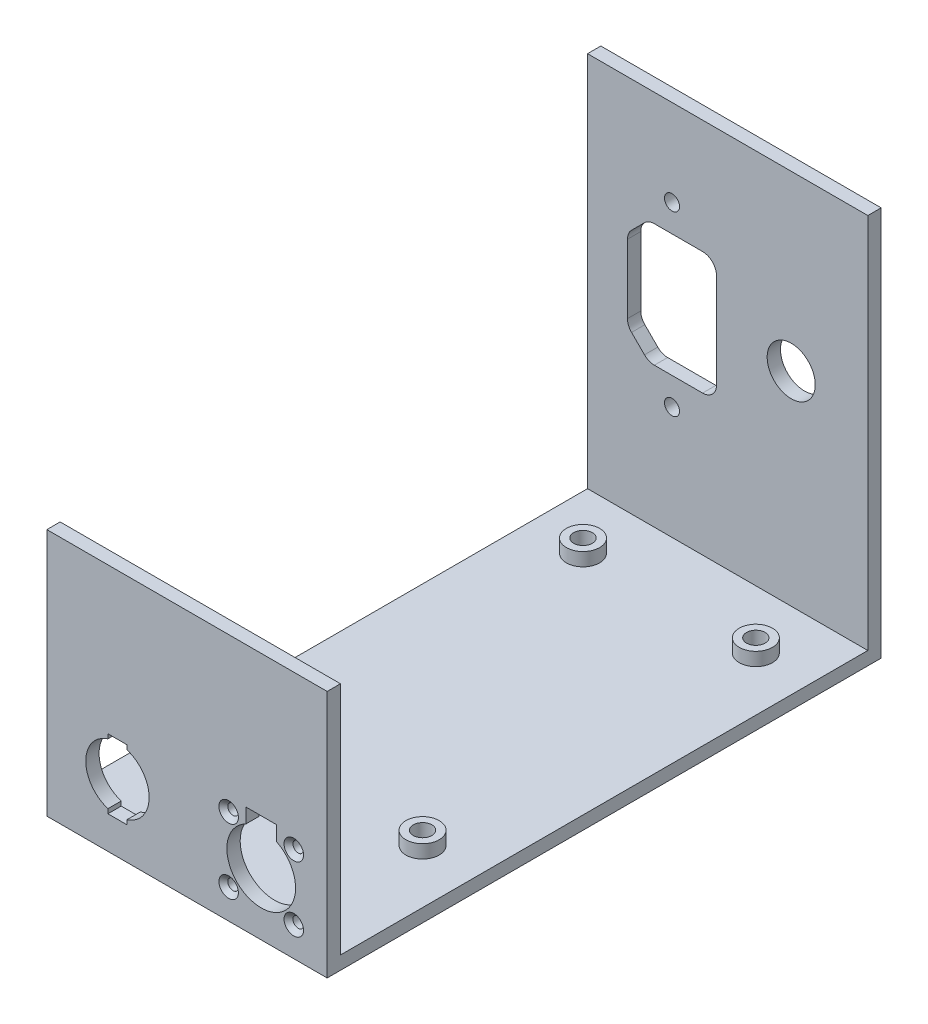
from build123d import *

# Parameters (mm, degrees)
SKETCH_2_R                  = 3.75
EXTRUDE_1_DEPTH             = 3
EXTRUDE_1_2_DEPTH           = 3
EXTRUDE_1_3_DEPTH           = 3
EXTRUDE_1_4_DEPTH           = 3
SKETCH_3_W                  = 63.25
SKETCH_3_H                  = 125
EXTRUDE_2_DEPTH             = 3
SKETCH_4_R                  = 2.1
CUT_EXTRUDE_1_DEPTH         = 4
SKETCH_5_W                  = 63.25
SKETCH_5_H                  = 3
EXTRUDE_3_DEPTH             = 53
CUT_EXTRUDE_2_DEPTH         = 10
HOLE_WIZARD_M21_D           = 2.4
HOLE_WIZARD_M21_DEPTH       = 5
HOLE_WIZARD_M21_CSINK_D     = 4.4
HOLE_WIZARD_M21_CSINK_ANGLE = 90
HOLE_WIZARD_M21_TIP         = 0.721032743
SKETCH_12_W                 = 63.25
SKETCH_12_H                 = 3
EXTRUDE_4_DEPTH             = 85
CUT_EXTRUDE_3_DEPTH         = 151.360036662
HOLE_WIZARD_M31_D           = 3.4
HOLE_WIZARD_M31_DEPTH       = 10
HOLE_WIZARD_M31_TIP         = 1.021463052
SKETCH_16_R                 = 5.425
CUT_EXTRUDE_4_DEPTH         = 151.360036662
CUT_EXTRUDE_5_DEPTH         = 151.360036662


with BuildPart() as part:
    # Эскиз2 → Бобышка-Вытянуть1 (new body)
    with BuildSketch(Plane.XZ):
        with Locations((19.5, 37.6)):
            Circle(SKETCH_2_R)
    extrude(amount=EXTRUDE_1_DEPTH)



with BuildPart() as body_2:
    # Эскиз2 → Extrude 1 2 (new body)
    with BuildSketch(Plane.XZ):
        with Locations((19.5, -37.6)):
            Circle(SKETCH_2_R)
    extrude(amount=EXTRUDE_1_2_DEPTH)


with BuildPart() as body_3:
    # Эскиз2 → Extrude 1 3 (new body)
    with BuildSketch(Plane.XZ):
        with Locations((-19.5, -37.6)):
            Circle(SKETCH_2_R)
    extrude(amount=EXTRUDE_1_3_DEPTH)


with BuildPart() as body_4:
    # Эскиз2 → Extrude 1 4 (new body)
    with BuildSketch(Plane.XZ):
        with Locations((-19.5, 37.6)):
            Circle(SKETCH_2_R)
    extrude(amount=EXTRUDE_1_4_DEPTH)


with BuildPart() as part_1:
    add(part.part)

    add(body_2.part)  # Бобышка-Вытянуть2 merges body 2

    add(body_3.part)  # Бобышка-Вытянуть2 merges body 3

    add(body_4.part)  # Бобышка-Вытянуть2 merges body 4
    # Эскиз3 → Бобышка-Вытянуть2 (add)
    with BuildSketch(Plane.XZ.offset(3)):
        with Locations((0, 8.75)):
            Rectangle(SKETCH_3_W, SKETCH_3_H)
    extrude(amount=EXTRUDE_2_DEPTH)

    # Эскиз4 → Вырез-Вытянуть1 (cut)
    with BuildSketch(Plane(origin=(0, 0, 0), x_dir=(1, 0, 0), z_dir=(0, 1, 0))):
        with Locations((19.5, 37.6)):
            Circle(SKETCH_4_R)
        with Locations((19.5, -37.6)):
            Circle(SKETCH_4_R)
        with Locations((-19.5, -37.6)):
            Circle(SKETCH_4_R)
        with Locations((-19.5, 37.6)):
            Circle(SKETCH_4_R)
    extrude(amount=-CUT_EXTRUDE_1_DEPTH, mode=Mode.SUBTRACT)

    # Эскиз5 → Бобышка-Вытянуть3 (add)
    with BuildSketch(Plane(origin=(0, -3, 0), x_dir=(1, 0, 0), z_dir=(0, 1, 0))):
        with Locations((0, -69.75)):
            Rectangle(SKETCH_5_W, SKETCH_5_H)
    extrude(amount=EXTRUDE_3_DEPTH)

    # Эскиз8 → Вырез-Вытянуть2 (cut)
    with BuildSketch(Plane.XY.offset(71.25)):
        with BuildLine():
            Line((20.195385143, 14.939740629), (20.195385143, 18.25))
            Line((20.195385143, 18.25), (13.295385143, 18.25))
            Line((13.295385143, 18.25), (13.295385143, 14.939740629))
            ThreePointArc((13.295385143, 14.939740629), (16.745385143, 0.25), (20.195385143, 14.939740629))
        make_face()
    extrude(amount=-CUT_EXTRUDE_2_DEPTH, mode=Mode.SUBTRACT)

    # Зенковка для винта с полупотайной головкой M21
    with Locations(Plane.XY.offset(71.25)):
        with Locations((9.395385143, 0.65), (24.095385143, 0.65), (9.395385143, 15.35), (24.095385143, 15.35)):
            CounterSinkHole(HOLE_WIZARD_M21_D / 2, HOLE_WIZARD_M21_CSINK_D / 2, depth=HOLE_WIZARD_M21_DEPTH, counter_sink_angle=HOLE_WIZARD_M21_CSINK_ANGLE)
            with Locations((0, 0, -(HOLE_WIZARD_M21_DEPTH + HOLE_WIZARD_M21_TIP / 2))):  # 118° drill point
                Cone(0, HOLE_WIZARD_M21_D / 2, HOLE_WIZARD_M21_TIP, mode=Mode.SUBTRACT)

    # Эскиз12 → Бобышка-Вытянуть4 (add)
    with BuildSketch(Plane(origin=(0, -3, 0), x_dir=(1, 0, 0), z_dir=(0, 1, 0))):
        with Locations((0, 52.25)):
            Rectangle(SKETCH_12_W, SKETCH_12_H)
    extrude(amount=EXTRUDE_4_DEPTH)

    # Эскиз13 → Вырез-Вытянуть3 (cut, through all)
    with BuildSketch(Plane.XY.offset(-50.75)):
        with BuildLine():
            Line((-16.5475667, 28.661241518), (-5.665207388, 28.661241518))
            ThreePointArc((-5.665207388, 28.661241518), (-3.437821027, 29.583855157), (-2.515207388, 31.811241518))
            Line((-2.515207388, 31.811241518), (-2.515207388, 53.161241518))
            ThreePointArc((-2.515207388, 53.161241518), (-3.437821027, 55.388627878), (-5.665207388, 56.311241518))
            Line((-5.665207388, 56.311241518), (-16.5475667, 56.311241518))
            ThreePointArc((-16.5475667, 56.311241518), (-17.753019512, 56.071462045), (-18.774953061, 55.388627878))
            Line((-18.774953061, 55.388627878), (-21.692593748, 52.470987191))
            ThreePointArc((-21.692593748, 52.470987191), (-22.375427915, 51.449053642), (-22.615207388, 50.243600831))
            Line((-22.615207388, 50.243600831), (-22.615207388, 34.728882205))
            ThreePointArc((-22.615207388, 34.728882205), (-22.375427915, 33.523429393), (-21.692593748, 32.501495844))
            Line((-21.692593748, 32.501495844), (-18.774953061, 29.583855157))
            ThreePointArc((-18.774953061, 29.583855157), (-17.753019512, 28.90102099), (-16.5475667, 28.661241518))
        make_face()
    extrude(amount=-CUT_EXTRUDE_3_DEPTH, mode=Mode.SUBTRACT)

    # Отверстие с зазором M31
    with Locations(Plane(origin=(0, 0, -53.75), x_dir=(-1, 0, 0), z_dir=(0, 0, -1))):
        with Locations((12.565207388, 22.486241518), (12.565207388, 62.486241518)):
            Hole(HOLE_WIZARD_M31_D / 2, depth=HOLE_WIZARD_M31_DEPTH)
            with Locations((0, 0, -(HOLE_WIZARD_M31_DEPTH + HOLE_WIZARD_M31_TIP / 2))):  # 118° drill point
                Cone(0, HOLE_WIZARD_M31_D / 2, HOLE_WIZARD_M31_TIP, mode=Mode.SUBTRACT)

    # Эскиз16 → Вырез-Вытянуть4 (cut, through all)
    with BuildSketch(Plane.XY.offset(-50.75)):
        with Locations((14.332152216, 42.973087252)):
            Circle(SKETCH_16_R)
    extrude(amount=-CUT_EXTRUDE_4_DEPTH, mode=Mode.SUBTRACT)

    # Эскиз17 → Вырез-Вытянуть5 (cut, through all)
    with BuildSketch(Plane(origin=(0, 0, 68.25), x_dir=(-1, 0, 0), z_dir=(0, 0, -1))):
        with BuildLine():
            Line((13.546897834, 15.992570959), (13.546897834, 16.992570959))
            Line((13.546897834, 16.992570959), (17.846897834, 16.992570959))
            Line((17.846897834, 16.992570959), (17.846897834, 15.992570959))
            ThreePointArc((17.846897834, 15.992570959), (22.846897834, 9.17348011), (17.846897834, 2.354389262))
            Line((17.846897834, 2.354389262), (17.846897834, 1.354389262))
            Line((17.846897834, 1.354389262), (13.546897834, 1.354389262))
            Line((13.546897834, 1.354389262), (13.546897834, 2.354389262))
            ThreePointArc((13.546897834, 2.354389262), (8.546897834, 9.17348011), (13.546897834, 15.992570959))
        make_face()
    extrude(amount=-CUT_EXTRUDE_5_DEPTH, mode=Mode.SUBTRACT)


solid = part_1.part
